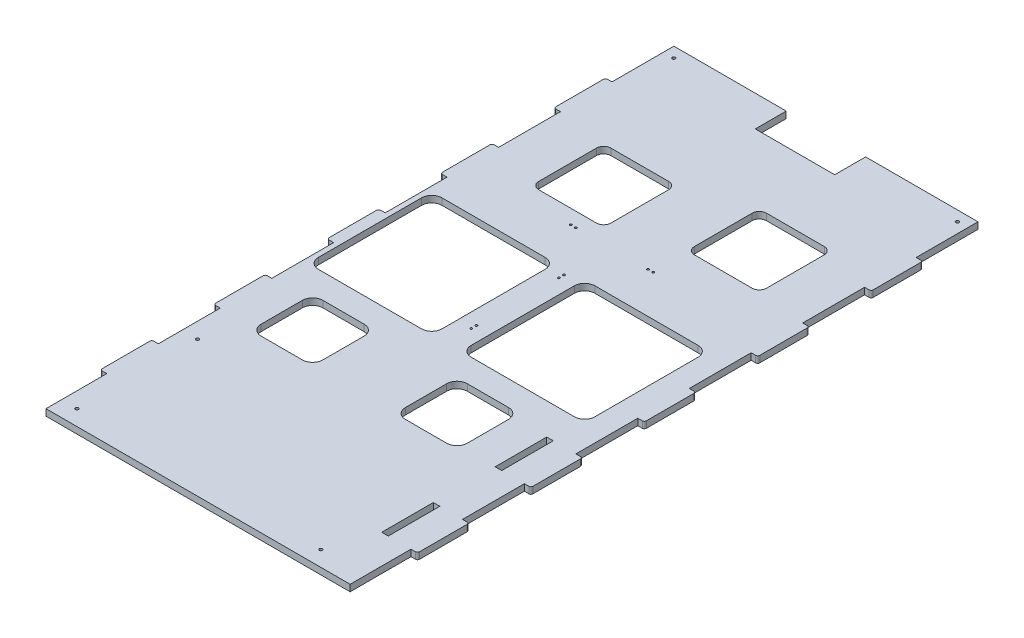
from build123d import *

# Parameters (mm, degrees)
BOSS_EXTRUDE1_DEPTH = 6.35
FILLET1_R           = 2
SKETCH2_R           = 1.5
SKETCH2_R_2         = 1.025
SKETCH2_W           = 6.35
SKETCH2_H           = 50
SKETCH2_W_2         = 120
SKETCH2_H_2         = 120
SKETCH2_W_3         = 77
SKETCH2_H_3         = 30
CUT_EXTRUDE1_DEPTH  = 6.35
FILLET2_R           = 10


with BuildPart() as part:
    # Sketch1 → Boss-Extrude1 (new body)
    with BuildSketch(Plane(origin=(0, 0, 0), x_dir=(1, 0, 0), z_dir=(0, 1, 0))):
        Polygon((0, 0), (295, 0), (295, 59), (301.35, 59), (301.35, 109), (295, 109), (295, 169), (301.35, 169), (301.35, 219), (295, 219), (295, 279), (301.35, 279), (301.35, 329), (295, 329), (295, 389), (301.35, 389), (301.35, 439), (295, 439), (295, 499), (301.35, 499), (301.35, 549), (295, 549), (295, 609), (0, 609), (0, 549), (-6.35, 549), (-6.35, 499), (0, 499), (0, 439), (-6.35, 439), (-6.35, 389), (0, 389), (0, 329), (-6.35, 329), (-6.35, 279), (0, 279), (0, 219), (-6.35, 219), (-6.35, 169), (0, 169), (0, 109), (-6.35, 109), (-6.35, 59), (0, 59), align=None)
    extrude(amount=BOSS_EXTRUDE1_DEPTH)

    # Fillet1
    fillet1_edges = [part.edges().sort_by_distance(p)[0] for p in [
        (301.35, 3.175, -549),
        (301.35, 3.175, -499),
        (301.35, 3.175, -439),
        (301.35, 3.175, -389),
        (301.35, 3.175, -329),
        (301.35, 3.175, -279),
        (301.35, 3.175, -219),
        (301.35, 3.175, -169),
        (301.35, 3.175, -109),
        (301.35, 3.175, -59),
        (-6.35, 3.175, -59),
        (-6.35, 3.175, -109),
        (-6.35, 3.175, -169),
        (-6.35, 3.175, -219),
        (-6.35, 3.175, -279),
        (-6.35, 3.175, -329),
        (-6.35, 3.175, -389),
        (-6.35, 3.175, -439),
        (-6.35, 3.175, -499),
        (-6.35, 3.175, -549),
    ]]
    fillet(fillet1_edges, radius=FILLET1_R)

    # Sketch2 → Cut-Extrude1 (cut)
    with BuildSketch(Plane(origin=(0, 6.35, 0), x_dir=(1, 0, 0), z_dir=(0, 1, 0))):
        with Locations((15, 15)):
            Circle(SKETCH2_R)
        with Locations((251.65, 15)):
            Circle(SKETCH2_R)
        with Locations((15, 131.925897501)):
            Circle(SKETCH2_R)
        with Locations((10, 599)):
            Circle(SKETCH2_R)
        with Locations((285, 599)):
            Circle(SKETCH2_R)
        with Locations((100, 409)):
            Circle(SKETCH2_R_2)
        with Locations((105, 409)):
            Circle(SKETCH2_R_2)
        with Locations((175, 409)):
            Circle(SKETCH2_R_2)
        with Locations((180, 409)):
            Circle(SKETCH2_R_2)
        with Locations((138.867349636, 363.576650138)):
            Circle(SKETCH2_R_2)
        with Locations((138.867349636, 358.576650138)):
            Circle(SKETCH2_R_2)
        with Locations((138.867349636, 278.576650138)):
            Circle(SKETCH2_R_2)
        with Locations((138.867349636, 273.576650138)):
            Circle(SKETCH2_R_2)
        with Locations((269.825, 194)):
            Rectangle(SKETCH2_W, SKETCH2_H)
        with Locations((269.825, 84)):
            Rectangle(SKETCH2_W, SKETCH2_H)
        with BuildLine():
            Line((55.042435698, 492.876808594), (111.042435698, 492.876808594))
            ThreePointArc((111.042435698, 492.876808594), (115.992183166, 490.826556062), (118.042435698, 485.876808594))
            Line((118.042435698, 485.876808594), (118.042435698, 429.876808594))
            ThreePointArc((118.042435698, 429.876808594), (115.992183166, 424.927061126), (111.042435698, 422.876808594))
            Line((111.042435698, 422.876808594), (55.042435698, 422.876808594))
            ThreePointArc((55.042435698, 422.876808594), (50.09268823, 424.927061126), (48.042435698, 429.876808594))
            Line((48.042435698, 429.876808594), (48.042435698, 485.876808594))
            ThreePointArc((48.042435698, 485.876808594), (50.09268823, 490.826556062), (55.042435698, 492.876808594))
        make_face()
        with BuildLine():
            Line((185.233522799, 513.658142081), (241.233522799, 513.658142081))
            ThreePointArc((241.233522799, 513.658142081), (246.183270267, 511.607889549), (248.233522799, 506.658142081))
            Line((248.233522799, 506.658142081), (248.233522799, 450.658142081))
            ThreePointArc((248.233522799, 450.658142081), (246.183270267, 445.708394612), (241.233522799, 443.658142081))
            Line((241.233522799, 443.658142081), (185.233522799, 443.658142081))
            ThreePointArc((185.233522799, 443.658142081), (180.283775331, 445.708394612), (178.233522799, 450.658142081))
            Line((178.233522799, 450.658142081), (178.233522799, 506.658142081))
            ThreePointArc((178.233522799, 506.658142081), (180.283775331, 511.607889549), (185.233522799, 513.658142081))
        make_face()
        with BuildLine():
            Line((43.325, 225.297977664), (83.325, 225.297977664))
            ThreePointArc((83.325, 225.297977664), (90.396067812, 222.369045476), (93.325, 215.297977664))
            Line((93.325, 215.297977664), (93.325, 175.297977664))
            ThreePointArc((93.325, 175.297977664), (90.396067812, 168.226909853), (83.325, 165.297977664))
            Line((83.325, 165.297977664), (43.325, 165.297977664))
            ThreePointArc((43.325, 165.297977664), (36.253932188, 168.226909853), (33.325, 175.297977664))
            Line((33.325, 175.297977664), (33.325, 215.297977664))
            ThreePointArc((33.325, 215.297977664), (36.253932188, 222.369045476), (43.325, 225.297977664))
        make_face()
        with Locations((65, 309.153604097)):
            Rectangle(SKETCH2_W_2, SKETCH2_H_2)
        with Locations((213, 309.452802196)):
            Rectangle(SKETCH2_W_2, SKETCH2_H_2)
        with BuildLine():
            Line((173.325, 215.297977664), (173.325, 175.297977664))
            ThreePointArc((173.325, 175.297977664), (176.253932188, 168.226909853), (183.325, 165.297977664))
            Line((183.325, 165.297977664), (223.325, 165.297977664))
            ThreePointArc((223.325, 165.297977664), (230.396067812, 168.226909853), (233.325, 175.297977664))
            Line((233.325, 175.297977664), (233.325, 215.297977664))
            ThreePointArc((233.325, 215.297977664), (230.396067812, 222.369045476), (223.325, 225.297977664))
            Line((223.325, 225.297977664), (183.325, 225.297977664))
            ThreePointArc((183.325, 225.297977664), (176.253932188, 222.369045476), (173.325, 215.297977664))
        make_face()
        with Locations((147.5, 594)):
            Rectangle(SKETCH2_W_3, SKETCH2_H_3)
    extrude(amount=-CUT_EXTRUDE1_DEPTH, mode=Mode.SUBTRACT)

    # Fillet2
    fillet2_edges = [part.edges().sort_by_distance(p)[0] for p in [
        (125, 3.175, -249.153604097),
        (5, 3.175, -249.153604097),
        (5, 3.175, -369.153604097),
        (125, 3.175, -369.153604097),
        (153, 3.175, -249.452802196),
        (273, 3.175, -249.452802196),
        (273, 3.175, -369.452802196),
        (153, 3.175, -369.452802196),
    ]]
    fillet(fillet2_edges, radius=FILLET2_R)


solid = part.part
